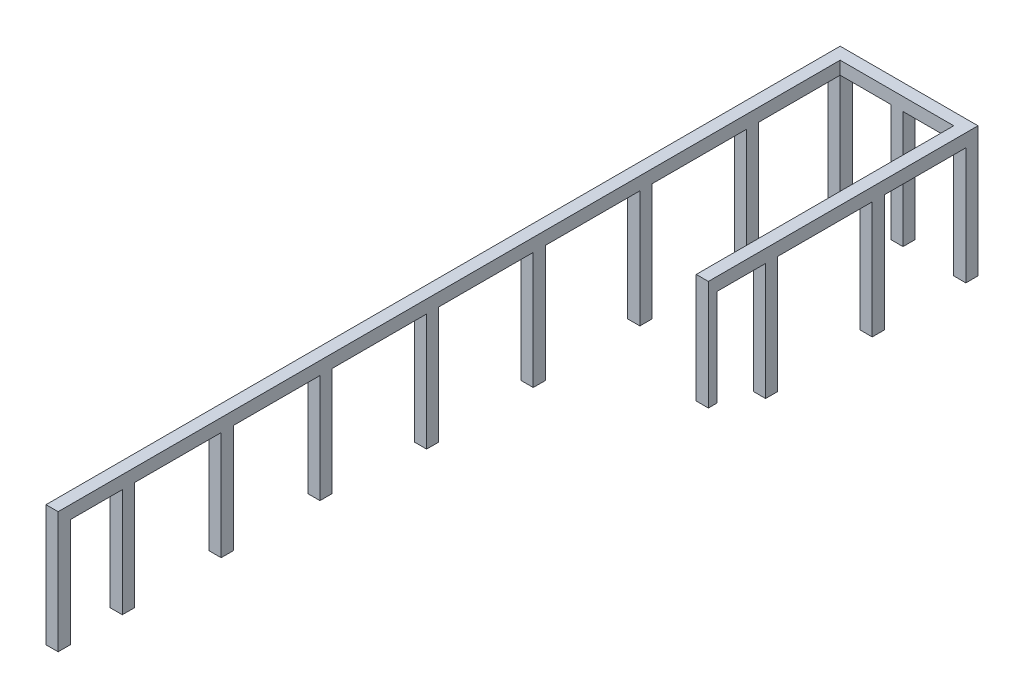
from build123d import *

# Parameters (mm, degrees)
SKETCH_1_W            = 2.8
SKETCH_1_H            = 2.8
EXTRUDE_1_DEPTH       = 30
EXTRUDE_1_2_DEPTH     = 30
EXTRUDE_1_3_DEPTH     = 30
EXTRUDE_1_4_DEPTH     = 30
EXTRUDE_1_5_DEPTH     = 30
EXTRUDE_1_6_DEPTH     = 30
EXTRUDE_1_7_DEPTH     = 30
EXTRUDE_1_8_DEPTH     = 30
EXTRUDE_1_9_DEPTH     = 30
EXTRUDE_1_10_DEPTH    = 30
EXTRUDE_1_11_DEPTH    = 30
EXTRUDE_1_12_DEPTH    = 30
EXTRUDE_1_13_DEPTH    = 30
EXTRUDE_START         = 27
EXTRUDE_2_OUTLINE_W   = 2.8
EXTRUDE_2_OUTLINE_H   = 18.8
EXTRUDE_2_OUTLINE_W_2 = 11.7
EXTRUDE_2_OUTLINE_H_2 = 2.8
EXTRUDE_2_OUTLINE_H_3 = 21.8
EXTRUDE_2_OUTLINE_H_4 = 20
EXTRUDE_2_OUTLINE_H_5 = 12
EXTRUDE_2_DEPTH       = 3
SKETCH_2_W            = 63.2
SKETCH_2_H            = 2
CUT_EXTRUDE_1_DEPTH   = 190.900710899
SKETCH_3_W            = 11.2
SKETCH_3_H            = 3
EXTRUDE_3_DEPTH       = 2.8


# Read off the part's stored shape, not the designer's step: 凸台-拉伸2
with BuildPart() as part:
    # 草图1 → 凸台-拉伸1 (new body)
    with BuildSketch(Plane(origin=(0, 0, 0), x_dir=(1, 0, 0), z_dir=(0, 1, 0))):
        with Locations((3, -3)):
            Rectangle(SKETCH_1_W, SKETCH_1_H)
    extrude(amount=EXTRUDE_1_DEPTH)



with BuildPart() as body_2:
    # 草图1 → Extrude 1 2 (new body)
    with BuildSketch(Plane(origin=(0, 0, 0), x_dir=(1, 0, 0), z_dir=(0, 1, 0))):
        with Locations((17.5, -3)):
            Rectangle(SKETCH_1_W, SKETCH_1_H)
    extrude(amount=EXTRUDE_1_2_DEPTH)


with BuildPart() as body_3:
    # 草图1 → Extrude 1 3 (new body)
    with BuildSketch(Plane(origin=(0, 0, 0), x_dir=(1, 0, 0), z_dir=(0, 1, 0))):
        with Locations((32, -3)):
            Rectangle(SKETCH_1_W, SKETCH_1_H)
    extrude(amount=EXTRUDE_1_3_DEPTH)


with BuildPart() as body_4:
    # 草图1 → Extrude 1 4 (new body)
    with BuildSketch(Plane(origin=(0, 0, 0), x_dir=(1, 0, 0), z_dir=(0, 1, 0))):
        with Locations((3, -24.6)):
            Rectangle(SKETCH_1_W, SKETCH_1_H)
    extrude(amount=EXTRUDE_1_4_DEPTH)


with BuildPart() as body_5:
    # 草图1 → Extrude 1 5 (new body)
    with BuildSketch(Plane(origin=(0, 0, 0), x_dir=(1, 0, 0), z_dir=(0, 1, 0))):
        with Locations((3, -49.2)):
            Rectangle(SKETCH_1_W, SKETCH_1_H)
    extrude(amount=EXTRUDE_1_5_DEPTH)


with BuildPart() as body_6:
    # 草图1 → Extrude 1 6 (new body)
    with BuildSketch(Plane(origin=(0, 0, 0), x_dir=(1, 0, 0), z_dir=(0, 1, 0))):
        with Locations((3, -73.8)):
            Rectangle(SKETCH_1_W, SKETCH_1_H)
    extrude(amount=EXTRUDE_1_6_DEPTH)


with BuildPart() as body_7:
    # 草图1 → Extrude 1 7 (new body)
    with BuildSketch(Plane(origin=(0, 0, 0), x_dir=(1, 0, 0), z_dir=(0, 1, 0))):
        with Locations((3, -98.4)):
            Rectangle(SKETCH_1_W, SKETCH_1_H)
    extrude(amount=EXTRUDE_1_7_DEPTH)


with BuildPart() as body_8:
    # 草图1 → Extrude 1 8 (new body)
    with BuildSketch(Plane(origin=(0, 0, 0), x_dir=(1, 0, 0), z_dir=(0, 1, 0))):
        with Locations((32, -49.2)):
            Rectangle(SKETCH_1_W, SKETCH_1_H)
    extrude(amount=EXTRUDE_1_8_DEPTH)


with BuildPart() as body_9:
    # 草图1 → Extrude 1 9 (new body)
    with BuildSketch(Plane(origin=(0, 0, 0), x_dir=(1, 0, 0), z_dir=(0, 1, 0))):
        with Locations((32, -24.6)):
            Rectangle(SKETCH_1_W, SKETCH_1_H)
    extrude(amount=EXTRUDE_1_9_DEPTH)


with BuildPart() as body_10:
    # 草图1 → Extrude 1 10 (new body)
    with BuildSketch(Plane(origin=(0, 0, 0), x_dir=(1, 0, 0), z_dir=(0, 1, 0))):
        with Locations((3, -123)):
            Rectangle(SKETCH_1_W, SKETCH_1_H)
    extrude(amount=EXTRUDE_1_10_DEPTH)


with BuildPart() as body_11:
    # 草图1 → Extrude 1 11 (new body)
    with BuildSketch(Plane(origin=(0, 0, 0), x_dir=(1, 0, 0), z_dir=(0, 1, 0))):
        with Locations((3, -145.8)):
            Rectangle(SKETCH_1_W, SKETCH_1_H)
    extrude(amount=EXTRUDE_1_11_DEPTH)


with BuildPart() as body_12:
    # 草图1 → Extrude 1 12 (new body)
    with BuildSketch(Plane(origin=(0, 0, 0), x_dir=(1, 0, 0), z_dir=(0, 1, 0))):
        with Locations((3, -168.6)):
            Rectangle(SKETCH_1_W, SKETCH_1_H)
    extrude(amount=EXTRUDE_1_12_DEPTH)


with BuildPart() as body_13:
    # 草图1 → Extrude 1 13 (new body)
    with BuildSketch(Plane(origin=(0, 0, 0), x_dir=(1, 0, 0), z_dir=(0, 1, 0))):
        with Locations((3, -183.4)):
            Rectangle(SKETCH_1_W, SKETCH_1_H)
    extrude(amount=EXTRUDE_1_13_DEPTH)


with BuildPart() as part_1:
    add(part.part)

    add(body_2.part)  # 凸台-拉伸2 merges body 2

    add(body_3.part)  # 凸台-拉伸2 merges body 3

    add(body_4.part)  # 凸台-拉伸2 merges body 4

    add(body_5.part)  # 凸台-拉伸2 merges body 5

    add(body_6.part)  # 凸台-拉伸2 merges body 6

    add(body_7.part)  # 凸台-拉伸2 merges body 7

    add(body_8.part)  # 凸台-拉伸2 merges body 8

    add(body_9.part)  # 凸台-拉伸2 merges body 9

    add(body_10.part)  # 凸台-拉伸2 merges body 10

    add(body_11.part)  # 凸台-拉伸2 merges body 11

    add(body_12.part)  # 凸台-拉伸2 merges body 12

    add(body_13.part)  # 凸台-拉伸2 merges body 13
    # 凸台-拉伸2 outline → 凸台-拉伸2 (add)
    with BuildSketch(Plane(origin=(0, 0, 0), x_dir=(1, 0, 0), z_dir=(0, 1, 0)).offset(EXTRUDE_START)):
        with Locations((32, -13.8)):
            Rectangle(EXTRUDE_2_OUTLINE_W, EXTRUDE_2_OUTLINE_H)
        with Locations((24.75, -3)):
            Rectangle(EXTRUDE_2_OUTLINE_W_2, EXTRUDE_2_OUTLINE_H_2)
        with Locations((10.25, -3)):
            Rectangle(EXTRUDE_2_OUTLINE_W_2, EXTRUDE_2_OUTLINE_H_2)
        with Locations((32, -36.9)):
            Rectangle(EXTRUDE_2_OUTLINE_W, EXTRUDE_2_OUTLINE_H_3)
        with Locations((3, -13.8)):
            Rectangle(EXTRUDE_2_OUTLINE_W, EXTRUDE_2_OUTLINE_H)
        with Locations((3, -36.9)):
            Rectangle(EXTRUDE_2_OUTLINE_W, EXTRUDE_2_OUTLINE_H_3)
        with Locations((3, -61.5)):
            Rectangle(EXTRUDE_2_OUTLINE_W, EXTRUDE_2_OUTLINE_H_3)
        with Locations((3, -86.1)):
            Rectangle(EXTRUDE_2_OUTLINE_W, EXTRUDE_2_OUTLINE_H_3)
        with Locations((3, -110.7)):
            Rectangle(EXTRUDE_2_OUTLINE_W, EXTRUDE_2_OUTLINE_H_3)
        with Locations((3, -134.4)):
            Rectangle(EXTRUDE_2_OUTLINE_W, EXTRUDE_2_OUTLINE_H_4)
        with Locations((3, -157.2)):
            Rectangle(EXTRUDE_2_OUTLINE_W, EXTRUDE_2_OUTLINE_H_4)
        with Locations((3, -176)):
            Rectangle(EXTRUDE_2_OUTLINE_W, EXTRUDE_2_OUTLINE_H_5)
    extrude(amount=EXTRUDE_2_DEPTH)

    # 草图2 → 切除-拉伸1 (cut, through all)
    with BuildSketch(Plane.ZY.offset(-1.6)):
        with Locations((153.2, 1)):
            Rectangle(SKETCH_2_W, SKETCH_2_H)
    extrude(amount=-CUT_EXTRUDE_1_DEPTH, mode=Mode.SUBTRACT)

    # 草图3 → 凸台-拉伸3 (add)
    with BuildSketch(Plane(origin=(33.4, 0, 0), x_dir=(0, 0, -1), z_dir=(1, 0, 0))):
        Polygon((-63.8, 4.7), (-61.8, 4.7), (-61.8, 27), (-61.8, 30), (-63.8, 30), align=None)
        with Locations((-56.2, 28.5)):
            Rectangle(SKETCH_3_W, SKETCH_3_H)
    extrude(amount=-EXTRUDE_3_DEPTH)


solid = part_1.part
